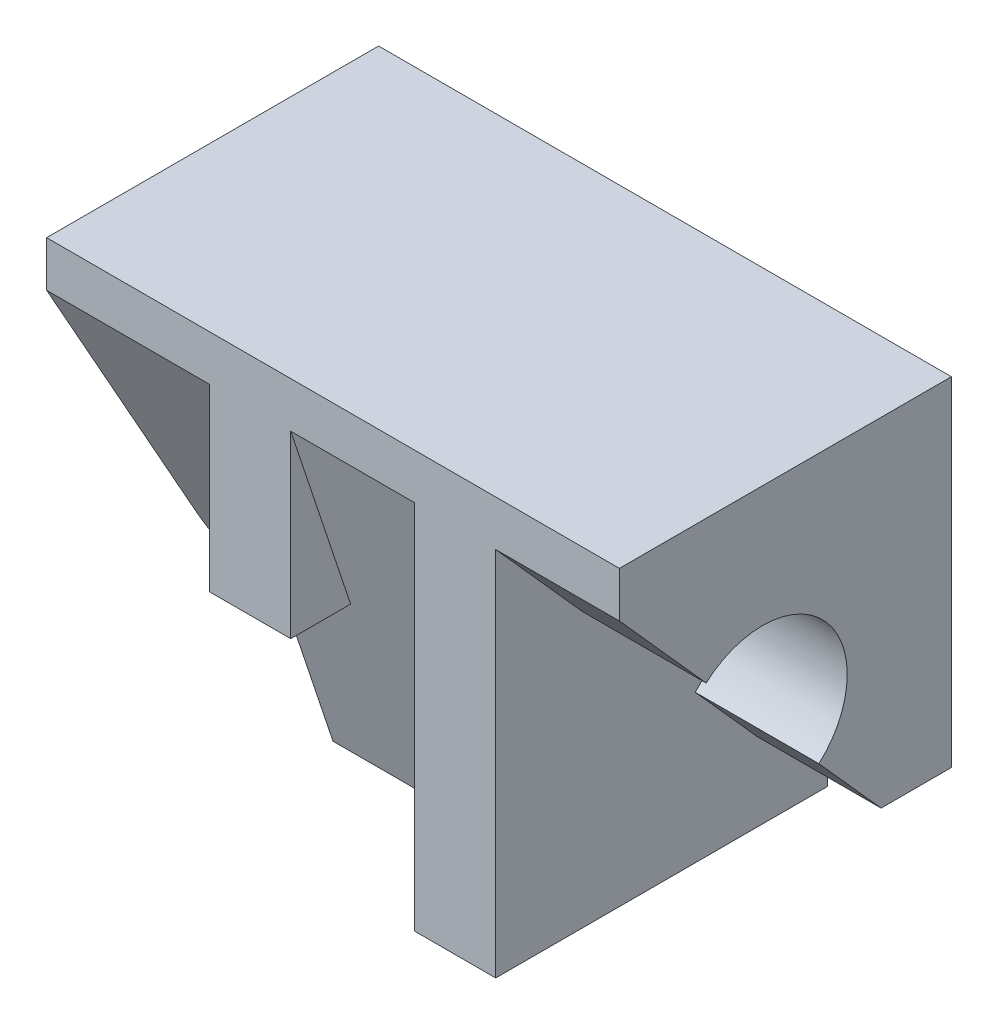
from build123d import *

# Parameters (mm, degrees)
SKETCH1_W            = 22
SKETCH1_H            = 32
BOSS_EXTRUDE1_DEPTH  = 25.5
CUT_EXTRUDE1_START   = -4.8125
CUT_EXTRUDE1_DEPTH   = 15.75
CUT_EXTRUDE1_START_2 = 1.4375
CUT_EXTRUDE1_2_DEPTH = 9.5
SKETCH8_W            = 9.5
SKETCH8_H            = 26
BOSS_EXTRUDE2_DEPTH  = 25.5
CUT_EXTRUDE2_DEPTH   = 9.5
SKETCH10_W           = 12.5
SKETCH10_H           = 32
BOSS_EXTRUDE3_DEPTH  = 25.5
CUT_EXTRUDE3_START   = -17.3125
CUT_EXTRUDE3_DEPTH   = 12.5
FILLET1_R            = 8


# Read off the part's stored shape, not the designer's step: Cut-Extrude1, Cut-Extrude3
with BuildPart() as part:
    # Sketch1 → Boss-Extrude1 (new body)
    with BuildSketch(Plane.XY):
        with Locations((6.1875, -13.307291667)):
            Rectangle(SKETCH1_W, SKETCH1_H)
    extrude(amount=BOSS_EXTRUDE1_DEPTH)

    # Cut-Extrude1 outline → Cut-Extrude1 (cut)
    with BuildSketch(Plane.YZ.offset(CUT_EXTRUDE1_START)):
        Polygon((-29.307291667, 25.5), (-29.307291667, 16), (-14.609886779, 20.899134963), (-14.609886779, 25.5), align=None)
    extrude(amount=CUT_EXTRUDE1_DEPTH, mode=Mode.SUBTRACT)

    # Cut-Extrude1 2 outline → Cut-Extrude1 2 (cut)
    with BuildSketch(Plane.YZ.offset(CUT_EXTRUDE1_START_2)):
        Polygon((-14.609886779, 25.5), (-14.609886779, 20.899134963), (-0.807291667, 25.5), align=None)
    extrude(amount=CUT_EXTRUDE1_2_DEPTH, mode=Mode.SUBTRACT)

    # Sketch8 → Boss-Extrude2 (add)
    with BuildSketch(Plane.XY):
        with Locations((21.9375, -10.307291667)):
            Rectangle(SKETCH8_W, SKETCH8_H)
    extrude(amount=BOSS_EXTRUDE2_DEPTH)

    # Sketch9 → Cut-Extrude2 (cut)
    with BuildSketch(Plane(origin=(26.6875, 0, 0), x_dir=(0, 0, -1), z_dir=(1, 0, 0))):
        with BuildLine():
            Line((-18.837056558, -8.265810445), (-25.5, -0.807291667))
            Line((-25.5, -0.807291667), (-25.5, -23.307291667))
            Line((-25.5, -23.307291667), (-5.4, -23.307291667))
            Line((-5.4, -23.307291667), (-10.176291277, -17.960696954))
            ThreePointArc((-10.176291277, -17.960696954), (-19.347447848, -17.437678411), (-18.837056558, -8.265810445))
        make_face()
        with BuildLine():
            ThreePointArc((-8, -13.107291667), (-11.848667092, -7.172611068), (-18.837056558, -8.265810445))
            Line((-18.837056558, -8.265810445), (-10.176291277, -17.960696954))
            ThreePointArc((-10.176291277, -17.960696954), (-8.568975354, -15.76679287), (-8, -13.107291667))
        make_face()
        with BuildLine():
            Line((-10.176291277, -17.960696954), (-18.837056558, -8.265810445))
            ThreePointArc((-18.837056558, -8.265810445), (-19.347447848, -17.437678411), (-10.176291277, -17.960696954))
        make_face()
    extrude(amount=-CUT_EXTRUDE2_DEPTH, mode=Mode.SUBTRACT)

    # Sketch10 → Boss-Extrude3 (add)
    with BuildSketch(Plane.XY):
        with Locations((-11.0625, -13.307291667)):
            Rectangle(SKETCH10_W, SKETCH10_H)
    extrude(amount=BOSS_EXTRUDE3_DEPTH)

    # Cut-Extrude3 outline → Cut-Extrude3 (cut)
    with BuildSketch(Plane.YZ.offset(CUT_EXTRUDE3_START)):
        Polygon((-29.307291667, 9.5), (-0.807291667, 25.5), (-29.307291667, 25.5), align=None)
    extrude(amount=CUT_EXTRUDE3_DEPTH, mode=Mode.SUBTRACT)

    # Fillet1
    fillet1_edges = [part.edges().sort_by_distance(p)[0] for p in [
        (-17.3125, -29.307291667, 4.75),
    ]]
    fillet(fillet1_edges, radius=FILLET1_R)


solid = part.part
